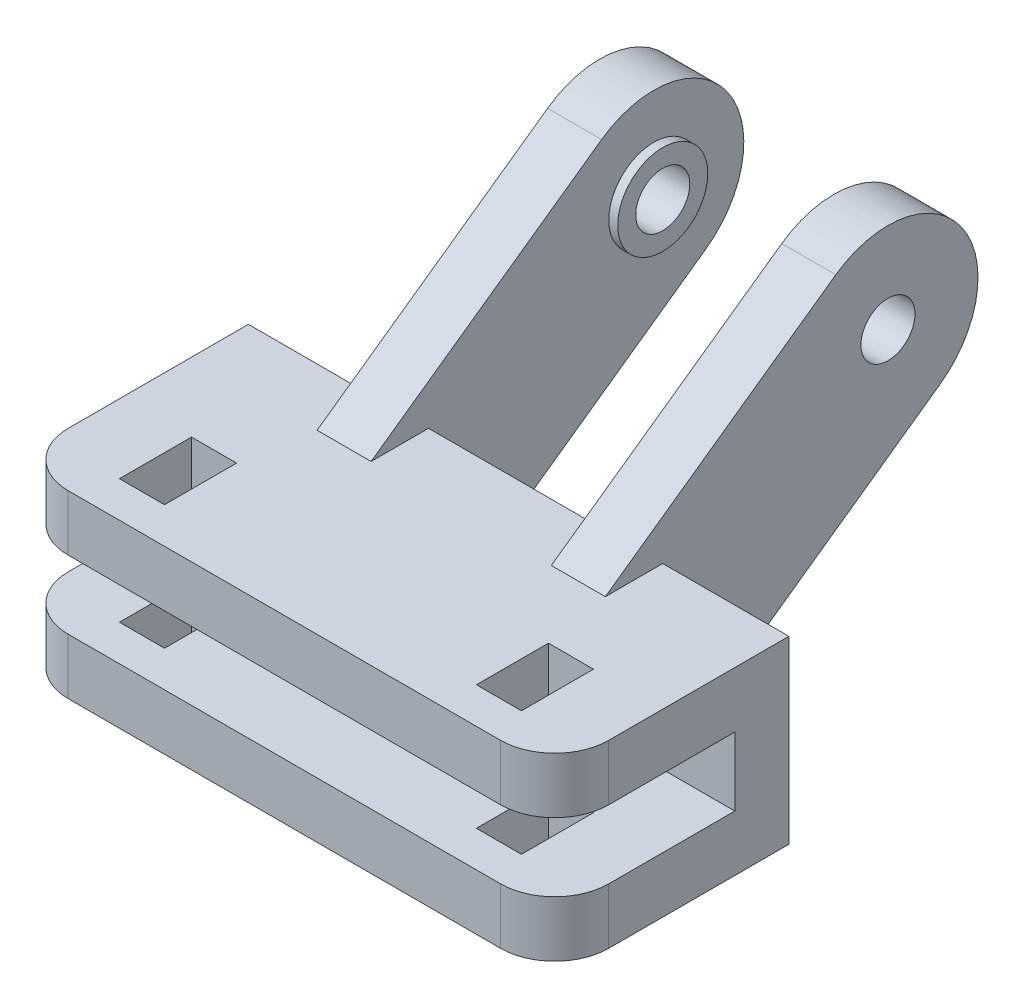
from build123d import *

# Parameters (mm, degrees)
ESBO_O1_W                  = 30
ESBO_O1_H                  = 10
RESSALTO_EXTRUS_O1_DEPTH   = 13
ESBO_O2_W                  = 30
ESBO_O2_H                  = 3.8
CORTE_EXTRUS_O1_DEPTH      = 10
FILETE1_R                  = 3
CORTE_EXTRUS_O2_DEPTH      = 23.226110771
CORTE_EXTRUS_O2_DEPTH_BACK = 23.226110771
ESBO_O3_W                  = 2.5
ESBO_O3_H                  = 4
ESBO_O4_W                  = 25
ESBO_O4_H                  = 25
RESSALTO_EXTRUS_O2_DEPTH   = 1.5
CHANFRO1_SIZE              = 5
CHANFRO1_SIZE_2            = 8.660254038
CHANFRO2_SIZE              = 7
CHANFRO2_SIZE2             = 4.041451884
ESBO_O5_R                  = 8.5
ESBO_O5_R_2                = 1
CORTE_EXTRUS_O3_DEPTH      = 3
FILETE2_R                  = 4
ESBO_O6_R                  = 1.5
RESSALTO_EXTRUS_O3_DEPTH   = 3
RESSALTO_EXTRUS_O4_START   = 0.5
ESBO_O7_R                  = 2.5
ESBO_O7_R_2                = 1.5
RESSALTO_EXTRUS_O4_DEPTH   = 0.5
CORTE_EXTRUS_O4_DEPTH      = 5


with BuildPart() as part:
    # Esboço1 → Ressalto-extrusão1 (new body)
    with BuildSketch(Plane.XY):
        Rectangle(ESBO_O1_W, ESBO_O1_H)
    extrude(amount=RESSALTO_EXTRUS_O1_DEPTH)

    # Esboço2 → Corte-extrusão1 (cut)
    with BuildSketch(Plane.XY.offset(13)):
        Rectangle(ESBO_O2_W, ESBO_O2_H)
    extrude(amount=-CORTE_EXTRUS_O1_DEPTH, mode=Mode.SUBTRACT)

    # Filete1
    filete1_edges = [part.edges().sort_by_distance(p)[0] for p in [
        (-15, 3.45, 13),
        (15, 3.45, 13),
        (-15, -3.45, 13),
        (15, -3.45, 13),
    ]]
    fillet(filete1_edges, radius=FILETE1_R)

    # Esboço3 → Corte-extrusão2 (cut, two sides: drawn at the far end of the back side and taken through both)
    with BuildSketch(Plane(origin=(0, 5, 0), x_dir=(1, 0, 0), z_dir=(0, 1, 0)).offset(-CORTE_EXTRUS_O2_DEPTH_BACK)):
        with Locations((9.906768391, -9)):
            Rectangle(ESBO_O3_W, ESBO_O3_H)
        with Locations((-9.906768391, -9)):
            Rectangle(ESBO_O3_W, ESBO_O3_H)
    extrude(amount=CORTE_EXTRUS_O2_DEPTH + CORTE_EXTRUS_O2_DEPTH_BACK, mode=Mode.SUBTRACT)

    # Esboço4 → Ressalto-extrusão2 (add, symmetric)
    with BuildSketch(Plane(origin=(13, 0, 0), x_dir=(0, 0, -1), z_dir=(1, 0, 0))):
        with Locations((12.5, 8.5)):
            Rectangle(ESBO_O4_W, ESBO_O4_H)
    extrude(amount=RESSALTO_EXTRUS_O2_DEPTH, both=True)

    # Chanfro1
    # the kernel refuses this chamfer: 8.660254038, 5 mm, written as the material it adds along each edge
    with BuildSketch(Plane(origin=(11.5, -4, 0), x_dir=(0, -0.9983227437537924, 0.05789386240267202), z_dir=(1, 0, 0))) as chanfro1_piece_1_section:
        Polygon((CHANFRO1_SIZE * 0.998322743754, CHANFRO1_SIZE * 0.0578938624027), (-CHANFRO1_SIZE_2 * 0.0578938624016, CHANFRO1_SIZE_2 * 0.998322743736), (0, 0), align=None)
    chanfro1_piece_1 = extrude(amount=3, mode=Mode.PRIVATE)
    chanfro1_piece_1 = split(chanfro1_piece_1, bisect_by=Plane(origin=(13, -5, -4.055902091), z_dir=(0, 1, 0)), keep=Keep.TOP, mode=Mode.PRIVATE)
    add(chanfro1_piece_1)

    # Chanfro2
    chanfro2_edges = [part.edges().sort_by_distance(p)[0] for p in [
        (13, 5, 0),
    ]]
    chanfro2_side = [part.faces().sort_by_distance(p)[0] for p in [
        (0, 5, 6.301932384),
    ]]
    chamfer(chanfro2_edges, length=CHANFRO2_SIZE, length2=CHANFRO2_SIZE2, reference=chanfro2_side[0])

    # Esboço5 → Corte-extrusão3 (cut)
    with BuildSketch(Plane.ZY.offset(-11.5)):
        with Locations((-12.5, 10)):
            Circle(ESBO_O5_R)
        with Locations((-20.2, 17.7)):
            Circle(ESBO_O5_R_2)
        with Locations((-4.8, 17.7)):
            Circle(ESBO_O5_R_2)
        with Locations((-4.8, 2.3)):
            Circle(ESBO_O5_R_2)
        with Locations((-20.2, 2.3)):
            Circle(ESBO_O5_R_2)
    extrude(amount=-CORTE_EXTRUS_O3_DEPTH, mode=Mode.SUBTRACT)

    # Filete2
    filete2_edges = [part.edges().sort_by_distance(p)[0] for p in [
        (13, 21, 0),
        (13, 21, -25),
        (13, -4, -25),
    ]]
    fillet(filete2_edges, radius=FILETE2_R)

    # Esboço6 → Ressalto-extrusão3 (add)
    with BuildSketch(Plane(origin=(-5, 0, 0), x_dir=(0, 0, -1), z_dir=(1, 0, 0))):
        with BuildLine():
            Line((9.606638802, 14.077800998), (-3.187293044, 5))
            Line((-3.187293044, 5), (0, 5))
            Line((0, 5), (0, -5))
            Line((0, -5), (15.393361198, 5.922199002))
            ThreePointArc((15.393361198, 5.922199002), (16.577800998, 12.893361198), (9.606638802, 14.077800998))
        make_face()
        with Locations((12.5, 10)):
            Circle(ESBO_O6_R, mode=Mode.SUBTRACT)
    ressalto_extrus_o3 = extrude(amount=-RESSALTO_EXTRUS_O3_DEPTH)

    # Esboço7 → Ressalto-extrusão4 (add)
    with BuildSketch(Plane(origin=(-5, 0, 0), x_dir=(0, 0, -1), z_dir=(1, 0, 0)).offset(RESSALTO_EXTRUS_O4_START)):
        with Locations((12.5, 10)):
            Circle(ESBO_O7_R)
        with Locations((12.5, 10)):
            Circle(ESBO_O7_R_2, mode=Mode.SUBTRACT)
    ressalto_extrus_o4 = extrude(amount=-RESSALTO_EXTRUS_O4_DEPTH)

    # Espelhar1: Ressalto-extrusão3, Ressalto-extrusão4 across plane
    add(ressalto_extrus_o3.mirror(Plane(origin=(0, 0, 0), x_dir=(0, 0, 1), z_dir=(1, 0, 0))))
    add(ressalto_extrus_o4.mirror(Plane(origin=(0, 0, 0), x_dir=(0, 0, 1), z_dir=(1, 0, 0))))

    # Esboço8 → Corte-extrusão4 (cut)
    with BuildSketch(Plane(origin=(15, 0, 0), x_dir=(0, 0, -1), z_dir=(1, 0, 0))):
        Polygon((-7.894114033, 22.521884482), (29.173309196, 22.521884482), (29.173309196, 5), (29.173309196, -5), (0, -5), (0, 5), (-7.894114033, 5), align=None)
    extrude(amount=-CORTE_EXTRUS_O4_DEPTH, mode=Mode.SUBTRACT)


solid = part.part
